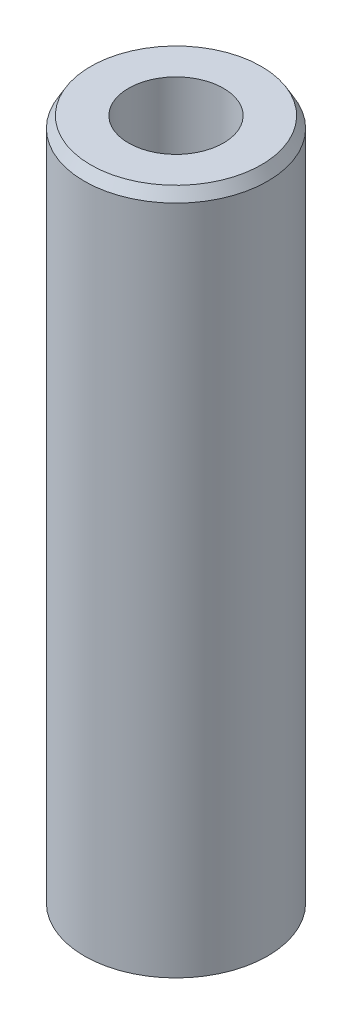
from build123d import *
from OCP.BRepFilletAPI import BRepFilletAPI_MakeChamfer

# Parameters (mm, degrees)
SKETCH1_R           = 50
BOSS_EXTRUDE1_DEPTH = 375.456607326
SKETCH2_R           = 25.902734548
CUT_EXTRUDE1_DEPTH  = 383.057147538
CHAMFER1_SIZE       = 5.985718118
CHAMFER1_SIZE2      = 3.455855967


with BuildPart() as part:
    # Sketch1 → Boss-Extrude1 (new body)
    with BuildSketch(Plane(origin=(0, 0, 0), x_dir=(1, 0, 0), z_dir=(0, 1, 0))):
        Circle(SKETCH1_R)
    extrude(amount=BOSS_EXTRUDE1_DEPTH)

    # Sketch2 → Cut-Extrude1 (cut, through all)
    with BuildSketch(Plane(origin=(0, 0, 0), x_dir=(1, 0, 0), z_dir=(0, 1, 0))):
        Circle(SKETCH2_R)
    extrude(amount=CUT_EXTRUDE1_DEPTH, mode=Mode.SUBTRACT)

    # Chamfer1: one chamfer whose edges measure the first distance from different faces: ONE call of the kernel's chamfer builder (chamfer() names one face for all edges)
    chamfer1_edges_1 = [part.edges().sort_by_distance(p)[0] for p in [
        (-50, 375.456607326, 0),
    ]]
    chamfer1_side_1 = [part.faces().sort_by_distance(p)[0] for p in [
        (-50, 187.728303663, 0),
    ]]
    chamfer1_edges_2 = [part.edges().sort_by_distance(p)[0] for p in [
        (-50, 0, 0),
    ]]
    chamfer1_side_2 = [part.faces().sort_by_distance(p)[0] for p in [
        (-48.585786438, 0, 0),
    ]]
    chamfer1 = BRepFilletAPI_MakeChamfer(part.part.solid().wrapped)
    for e in chamfer1_edges_1:
        chamfer1.Add(CHAMFER1_SIZE, CHAMFER1_SIZE2, e.wrapped, chamfer1_side_1[0].wrapped)  # the first distance lies on this face
    for e in chamfer1_edges_2:
        chamfer1.Add(CHAMFER1_SIZE, CHAMFER1_SIZE2, e.wrapped, chamfer1_side_2[0].wrapped)  # the first distance lies on this face
    add(Compound.cast(chamfer1.Shape()), mode=Mode.REPLACE)


solid = part.part
